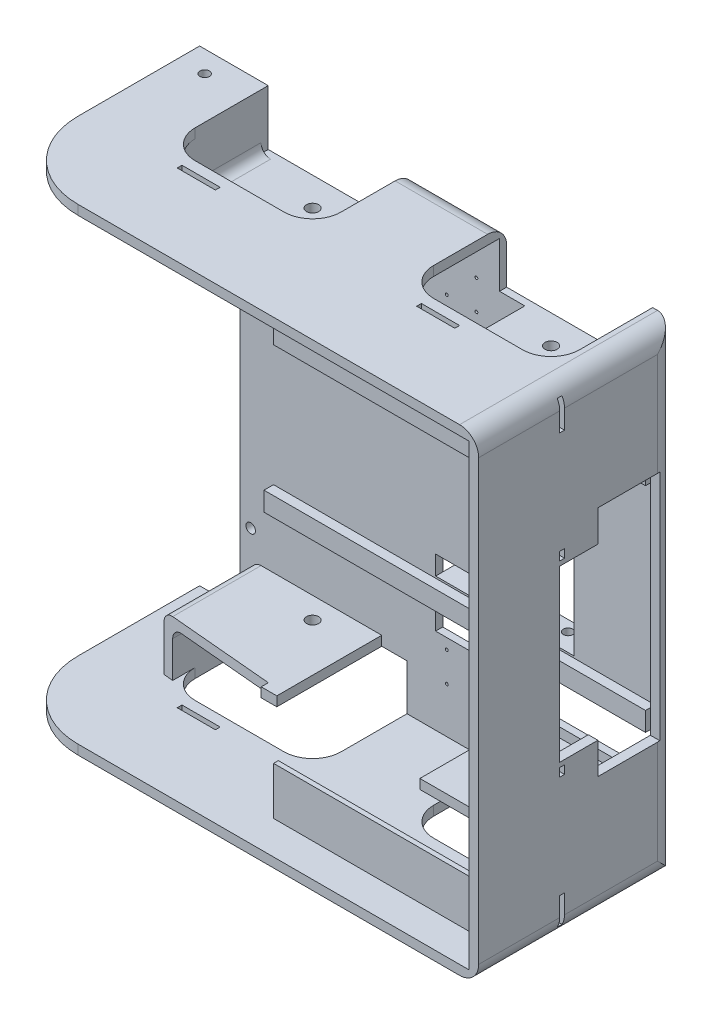
from build123d import *

# Parameters (mm, degrees)
SKETCH2_W           = 500
SKETCH2_H           = 500
BOSS_EXTRUDE1_DEPTH = 7.5
BOSS_EXTRUDE2_DEPTH = 200
SKETCH4_W           = 100
SKETCH4_H           = 10
BOSS_EXTRUDE3_DEPTH = 110
CUT_EXTRUDE3_REACH  = 598.285
CUT_EXTRUDE4_START  = -58
CUT_EXTRUDE4_DEPTH  = 58
SKETCH7_R           = 6.35
CUT_EXTRUDE5_DEPTH  = 500
SKETCH8_W           = 150
SKETCH8_H           = 50
CUT_EXTRUDE6_DEPTH  = 10
CUT_EXTRUDE9_DEPTH  = 10
SKETCH12_W          = 50
SKETCH12_H          = 20
BOSS_EXTRUDE4_DEPTH = 30
SKETCH13_R          = 5
CUT_EXTRUDE10_DEPTH = 500
SKETCH14_W          = 50
SKETCH14_H          = 20
CUT_EXTRUDE11_DEPTH = 1000
SKETCH15_W          = 399.926527146
SKETCH15_H          = 20
BOSS_EXTRUDE5_DEPTH = 10
CUT_EXTRUDE12_DEPTH = 500
SKETCH17_W          = 50
SKETCH17_H          = 480
CUT_EXTRUDE13_DEPTH = 500
FILLET2_R           = 20
CUT_EXTRUDE14_DEPTH = 38
SKETCH19_R          = 5
CUT_EXTRUDE15_DEPTH = 10
BOSS_EXTRUDE6_REACH = 408.202
SKETCH21_R          = 5
CUT_EXTRUDE16_DEPTH = 500
SKETCH22_W          = 40
SKETCH22_H          = 5
CUT_EXTRUDE17_DEPTH = 1000
SKETCH23_W          = 5
SKETCH23_H          = 30
SKETCH23_H_2        = 8.75
CUT_EXTRUDE18_DEPTH = 20
SKETCH25_R          = 1.5
CUT_EXTRUDE19_DEPTH = 50
SKETCH26_W          = 50
SKETCH26_H          = 20
BOSS_EXTRUDE7_DEPTH = 22.5
SKETCH28_R          = 5
CUT_EXTRUDE20_DEPTH = 250
SKETCH29_W          = 240
SKETCH29_H          = 5
BOSS_EXTRUDE8_DEPTH = 50


with BuildPart() as part:
    # Sketch2 → Boss-Extrude1 (new body)
    with BuildSketch(Plane.XY):
        Rectangle(SKETCH2_W, SKETCH2_H)
    extrude(amount=BOSS_EXTRUDE1_DEPTH)

    # Sketch3 → Boss-Extrude2 (add)
    with BuildSketch(Plane.XY.offset(7.5)):
        Polygon((-250, 250), (-250, 240), (-240, 240), (240, 240), (240, -240), (-240, -240), (-250, -240), (-250, -250), (250, -250), (250, 250), align=None)
    extrude(amount=BOSS_EXTRUDE2_DEPTH)

    # Sketch4 → Boss-Extrude3 (add)
    with BuildSketch(Plane.XY.offset(7.5)):
        with Locations((148.4, 187)):
            Rectangle(SKETCH4_W, SKETCH4_H)
        with Locations((148.4, -187)):
            Rectangle(SKETCH4_W, SKETCH4_H)
        with Locations((-101.6, 187)):
            Rectangle(SKETCH4_W, SKETCH4_H)
        with Locations((-101.6, -187)):
            Rectangle(SKETCH4_W, SKETCH4_H)
    extrude(amount=BOSS_EXTRUDE3_DEPTH)

    # Cut-Extrude3: up to this face of the body (flat: up to its plane)
    cut_extrude3_end = Plane(part.part.faces().sort_by_distance((148.4, 192, 62.5))[0])
    # Sketch5 → Cut-Extrude3 (cut, up to the picked face)
    with BuildSketch(Plane(origin=(0, 250, 0), x_dir=(1, 0, 0), z_dir=(0, 1, 0)), mode=Mode.PRIVATE) as cut_extrude3_sk1:
        with BuildLine():
            Line((71.9, 46.5), (224.9, 46.5))
            Line((224.9, 46.5), (224.9, -76.5))
            ThreePointArc((224.9, -76.5), (216.113203436, -97.713203436), (194.9, -106.5))
            Line((194.9, -106.5), (101.9, -106.5))
            ThreePointArc((101.9, -106.5), (80.686796564, -97.713203436), (71.9, -76.5))
            Line((71.9, -76.5), (71.9, 46.5))
        make_face()
    cut_extrude3_tool1 = split(extrude(cut_extrude3_sk1.sketch, amount=-CUT_EXTRUDE3_REACH, mode=Mode.PRIVATE), bisect_by=cut_extrude3_end, keep=Keep.BOTH, mode=Mode.PRIVATE)
    # Sketch5 → Cut-Extrude3 (cut, up to the picked face)
    with BuildSketch(Plane(origin=(0, 250, 0), x_dir=(1, 0, 0), z_dir=(0, 1, 0)), mode=Mode.PRIVATE) as cut_extrude3_sk2:
        with BuildLine():
            Line((-178.1, 46.5), (-178.1, -76.5))
            ThreePointArc((-178.1, -76.5), (-169.313203436, -97.713203436), (-148.1, -106.5))
            Line((-148.1, -106.5), (-55.1, -106.5))
            ThreePointArc((-55.1, -106.5), (-33.886796564, -97.713203436), (-25.1, -76.5))
            Line((-25.1, -76.5), (-25.1, 46.5))
            Line((-25.1, 46.5), (-178.1, 46.5))
        make_face()
    cut_extrude3_tool2 = split(extrude(cut_extrude3_sk2.sketch, amount=-CUT_EXTRUDE3_REACH, mode=Mode.PRIVATE), bisect_by=cut_extrude3_end, keep=Keep.BOTH, mode=Mode.PRIVATE)
    add(cut_extrude3_tool1.solids().sort_by(Axis((148.4, 250, 28.828888), (0, -1, 0)))[0], mode=Mode.SUBTRACT)
    add(cut_extrude3_tool2.solids().sort_by(Axis((-101.6, 250, 28.828888), (0, -1, 0)))[0], mode=Mode.SUBTRACT)

    # Sketch6 → Cut-Extrude4 (cut)
    with BuildSketch(Plane.XZ.offset(250).offset(CUT_EXTRUDE4_START)):
        with BuildLine():
            Line((224.9, 0), (71.9, 0))
            Line((71.9, 0), (71.9, 76.5))
            ThreePointArc((71.9, 76.5), (80.686796564, 97.713203436), (101.9, 106.5))
            Line((101.9, 106.5), (194.9, 106.5))
            ThreePointArc((194.9, 106.5), (216.113203436, 97.713203436), (224.9, 76.5))
            Line((224.9, 76.5), (224.9, 0))
        make_face()
        with BuildLine():
            Line((-25.1, 0), (-178.1, 0))
            Line((-178.1, 0), (-178.1, 76.5))
            ThreePointArc((-178.1, 76.5), (-169.313203436, 97.713203436), (-148.1, 106.5))
            Line((-148.1, 106.5), (-55.1, 106.5))
            ThreePointArc((-55.1, 106.5), (-33.886796564, 97.713203436), (-25.1, 76.5))
            Line((-25.1, 76.5), (-25.1, 0))
        make_face()
    extrude(amount=CUT_EXTRUDE4_DEPTH, mode=Mode.SUBTRACT)

    # Sketch7 → Cut-Extrude5 (cut, symmetric)
    with BuildSketch(Plane(origin=(0, -182, 0), x_dir=(1, 0, 0), z_dir=(0, 1, 0))):
        with Locations(Location((148.4, -30, 0), (0, 0, 270))):
            Circle(SKETCH7_R)
        with Locations(Location((-101.6, -30, 0), (0, 0, 270))):
            Circle(SKETCH7_R)
    extrude(amount=CUT_EXTRUDE5_DEPTH, both=True, mode=Mode.SUBTRACT)

    # Sketch8 → Cut-Extrude6 (cut)
    with BuildSketch(Plane.XY.offset(7.5)):
        with Locations((159.9, 147)):
            Rectangle(SKETCH8_W, SKETCH8_H)
        with Locations((159.9, -147)):
            Rectangle(SKETCH8_W, SKETCH8_H)
    extrude(amount=-CUT_EXTRUDE6_DEPTH, mode=Mode.SUBTRACT)

    # Sketch11 → Cut-Extrude9 (cut)
    with BuildSketch(Plane(origin=(0, -182, 0), x_dir=(1, 0, 0), z_dir=(0, 1, 0))):
        Polygon((-151.6, -117.5), (-91.6, -117.5), (-67.982681626, -117.5), (-67.982681626, -110), (-151.6, -102.5), align=None)
    cut_extrude9 = extrude(amount=-CUT_EXTRUDE9_DEPTH, mode=Mode.SUBTRACT)

    # Mirror1: Cut-Extrude9 across plane
    add(cut_extrude9.mirror(Plane.ZX), mode=Mode.SUBTRACT)

    # Sketch12 → Boss-Extrude4 (add)
    with BuildSketch(Plane.XY.offset(7.5)):
        with Locations((125, -110)):
            Rectangle(SKETCH12_W, SKETCH12_H)
        with Locations((125, 110)):
            Rectangle(SKETCH12_W, SKETCH12_H)
    extrude(amount=-BOSS_EXTRUDE4_DEPTH)

    # Sketch13 → Cut-Extrude10 (cut, symmetric)
    with BuildSketch(Plane.XZ.offset(-100)):
        with Locations(Location((125, -11.25, 0), (0, 0, 270))):
            Circle(SKETCH13_R)
    extrude(amount=CUT_EXTRUDE10_DEPTH, both=True, mode=Mode.SUBTRACT)

    # Sketch14 → Cut-Extrude11 (cut)
    with BuildSketch(Plane(origin=(0, 0, 0), x_dir=(-1, 0, 0), z_dir=(0, 0, -1))):
        Polygon((-150, -100), (-100, -100), (-90.165859907, -100), (-90.165859907, 100), (-100, 100), (-150, 100), align=None)
        with Locations((-29.9, -140)):
            Rectangle(SKETCH14_W, SKETCH14_H)
        with Locations((-29.9, -90)):
            Rectangle(SKETCH14_W, SKETCH14_H)
        with Locations((-29.9, 90)):
            Rectangle(SKETCH14_W, SKETCH14_H)
        with Locations((-29.9, 140)):
            Rectangle(SKETCH14_W, SKETCH14_H)
    extrude(amount=-CUT_EXTRUDE11_DEPTH, mode=Mode.SUBTRACT)

    # Sketch15 → Boss-Extrude5 (add)
    with BuildSketch(Plane.XY.offset(7.5)):
        with Locations((34.936736427, 112)):
            Rectangle(SKETCH15_W, SKETCH15_H)
        with Locations((34.936736427, -112)):
            Rectangle(SKETCH15_W, SKETCH15_H)
    extrude(amount=BOSS_EXTRUDE5_DEPTH)

    # Sketch16 → Cut-Extrude12 (cut)
    with BuildSketch(Plane(origin=(0, 250, 0), x_dir=(1, 0, 0), z_dir=(0, 1, 0))):
        with BuildLine():
            Line((-250, -127.5), (-250, 0))
            Line((-250, 0), (-350.342339136, 0))
            Line((-350.342339136, 0), (-350.342339136, -261.626610271))
            Line((-350.342339136, -261.626610271), (250, -261.626610271))
            Line((250, -261.626610271), (250, -207.5))
            Line((250, -207.5), (-170, -207.5))
            ThreePointArc((-170, -207.5), (-226.568542495, -184.068542495), (-250, -127.5))
        make_face()
    extrude(amount=-CUT_EXTRUDE12_DEPTH, mode=Mode.SUBTRACT)

    # Sketch17 → Cut-Extrude13 (cut)
    with BuildSketch(Plane.XY.offset(7.5)):
        with Locations((-225, 0)):
            Rectangle(SKETCH17_W, SKETCH17_H)
    extrude(amount=-CUT_EXTRUDE13_DEPTH, mode=Mode.SUBTRACT)

    # Fillet2
    # the kernel refuses this fillet: 20 mm, written as the material it takes off along each edge
    with BuildSketch(Plane(origin=(-75.1, -250, 0), x_dir=(0, 0, 1), z_dir=(1, 0, 0)), Plane(origin=(121.9, 250, 0), x_dir=(0, 0, 1), z_dir=(-1, 0, 0))) as fillet2_piece_1:
        with BuildLine():
            CenterArc((FILLET2_R, -FILLET2_R), FILLET2_R, 90, 90)
            Line((0, -FILLET2_R), (0, 0))
            Line((0, 0), (FILLET2_R, 0))
        make_face()
    extrude(amount=197, mode=Mode.SUBTRACT)
    with BuildSketch(Plane(origin=(250, -300, 0), x_dir=(0, 0, 1), z_dir=(0, 1, 0))) as fillet2_piece_2:
        with BuildLine():
            CenterArc((FILLET2_R, -FILLET2_R), FILLET2_R, 90, 90)
            Line((0, -FILLET2_R), (0, 0))
            Line((0, 0), (FILLET2_R, 0))
        make_face()
    extrude(amount=600, mode=Mode.SUBTRACT)
    with BuildSketch(Plane(origin=(250, -250, -50), x_dir=(-1, 0, 0), z_dir=(0, 0, 1))) as fillet2_piece_3:
        with BuildLine():
            CenterArc((FILLET2_R, -FILLET2_R), FILLET2_R, 90, 90)
            Line((0, -FILLET2_R), (0, 0))
            Line((0, 0), (FILLET2_R, 0))
        make_face()
    extrude(amount=307.5, mode=Mode.SUBTRACT)
    with BuildSketch(Plane(origin=(250, 250, -50), x_dir=(-1, 0, 0), z_dir=(0, 0, 1))) as fillet2_piece_4:
        with BuildLine():
            CenterArc((FILLET2_R, FILLET2_R), FILLET2_R, 180, 90)
            Line((0, FILLET2_R), (0, 0))
            Line((0, 0), (FILLET2_R, 0))
        make_face()
    extrude(amount=307.5, mode=Mode.SUBTRACT)

    # Sketch18 → Cut-Extrude14 (cut)
    with BuildSketch(Plane.ZY.offset(-240)):
        Polygon((17.5, 122), (82.5, 122), (82.5, 89), (122.5, 89), (122.5, -89), (82.5, -89), (82.5, -122), (17.5, -122), align=None)
    extrude(amount=-CUT_EXTRUDE14_DEPTH, mode=Mode.SUBTRACT)

    # Sketch19 → Cut-Extrude15 (cut)
    with BuildSketch(Plane.XY.offset(7.5)):
        with Locations((-189, 153.5)):
            Circle(SKETCH19_R)
        with Locations(Location((-189, -153.5, 0), (0, 0, 180))):
            Circle(SKETCH19_R)
    extrude(amount=-CUT_EXTRUDE15_DEPTH, mode=Mode.SUBTRACT)

    # Boss-Extrude6: up to this plane
    boss_extrude6_end = Plane(origin=(-67.982681626, 192, 110), z_dir=(-0.08933570149231775, 0, 0.9960015725082343))
    # Sketch20 → Boss-Extrude6 (add, up to the surface)
    with BuildSketch(Plane.XY.offset(7.5), mode=Mode.PRIVATE) as boss_extrude6_sk1:
        with BuildLine():
            Line((-178.1, 240), (-178.1, 202))
            ThreePointArc((-178.1, 202), (-175.171067812, 194.928932188), (-168.1, 192))
            Line((-168.1, 192), (-151.6, 192))
            Line((-151.6, 192), (-151.6, 182))
            Line((-151.6, 182), (-178.1, 182))
            ThreePointArc((-178.1, 182), (-185.171067812, 184.928932188), (-188.1, 192))
            Line((-188.1, 192), (-188.1, 240))
            Line((-188.1, 240), (-178.1, 240))
        make_face()
    boss_extrude6_tool1 = split(extrude(boss_extrude6_sk1.sketch, amount=BOSS_EXTRUDE6_REACH, mode=Mode.PRIVATE), bisect_by=boss_extrude6_end, keep=Keep.BOTH, mode=Mode.PRIVATE)
    boss_extrude6 = boss_extrude6_tool1.solids().sort_by_distance((-178.785292, 221, 7.5))[0]
    add(boss_extrude6)

    # Mirror2: Boss-Extrude6 across plane
    add(boss_extrude6.mirror(Plane.ZX))

    # Sketch21 → Cut-Extrude16 (cut, symmetric)
    with BuildSketch(Plane(origin=(0, -240, 0), x_dir=(1, 0, 0), z_dir=(0, 1, 0))):
        with Locations(Location((-222.174829667, -22.5, 0), (0, 0, 270))):
            Circle(SKETCH21_R)
    extrude(amount=CUT_EXTRUDE16_DEPTH, both=True, mode=Mode.SUBTRACT)

    # Sketch22 → Cut-Extrude17 (cut)
    with BuildSketch(Plane.XZ.offset(250)):
        with Locations((-131, 120)):
            Rectangle(SKETCH22_W, SKETCH22_H)
        with Locations((120, 120)):
            Rectangle(SKETCH22_W, SKETCH22_H)
    extrude(amount=-CUT_EXTRUDE17_DEPTH, mode=Mode.SUBTRACT)

    # Sketch23 → Cut-Extrude18 (cut)
    with BuildSketch(Plane(origin=(250, 0, 0), x_dir=(0, 0, -1), z_dir=(1, 0, 0))):
        with Locations((-120, -225)):
            Rectangle(SKETCH23_W, SKETCH23_H)
        with Locations((-120, -98.125)):
            Rectangle(SKETCH23_W, SKETCH23_H_2)
        with Locations((-120, 98.125)):
            Rectangle(SKETCH23_W, SKETCH23_H_2)
        with Locations((-120, 225)):
            Rectangle(SKETCH23_W, SKETCH23_H)
    extrude(amount=-CUT_EXTRUDE18_DEPTH, mode=Mode.SUBTRACT)

    # Sketch25 → Cut-Extrude19 (cut)
    with BuildSketch(Plane.XY.offset(7.5)):
        with Locations((16.625, -161.130490871)):
            Circle(SKETCH25_R)
        with Locations((47.625, -161.130490871)):
            Circle(SKETCH25_R)
        with Locations((47.625, -192.130490871)):
            Circle(SKETCH25_R)
        with Locations((16.625, -192.130490871)):
            Circle(SKETCH25_R)
        with Locations(Location((16.625, 192.130490871, 0), (0, 0, 180))):
            Circle(SKETCH25_R)
        with Locations(Location((47.625, 192.130490871, 0), (0, 0, 180))):
            Circle(SKETCH25_R)
        with Locations(Location((47.625, 161.130490871, 0), (0, 0, 180))):
            Circle(SKETCH25_R)
        with Locations(Location((16.625, 161.130490871, 0), (0, 0, 180))):
            Circle(SKETCH25_R)
    extrude(amount=-CUT_EXTRUDE19_DEPTH, mode=Mode.SUBTRACT)

    # Sketch26 → Boss-Extrude7 (add)
    with BuildSketch(Plane(origin=(0, 0, 0), x_dir=(-1, 0, 0), z_dir=(0, 0, -1))):
        with Locations((-29.9, 110)):
            Rectangle(SKETCH26_W, SKETCH26_H)
        with Locations((-29.9, -110)):
            Rectangle(SKETCH26_W, SKETCH26_H)
    extrude(amount=BOSS_EXTRUDE7_DEPTH)

    # Sketch28 → Cut-Extrude20 (cut)
    with BuildSketch(Plane(origin=(0, 120, 0), x_dir=(1, 0, 0), z_dir=(0, 1, 0))):
        with Locations(Location((29.9, 11.25, 0), (0, 0, 270))):
            Circle(SKETCH28_R)
    extrude(amount=-CUT_EXTRUDE20_DEPTH, mode=Mode.SUBTRACT)

    # Sketch29 → Boss-Extrude8 (add)
    with BuildSketch(Plane(origin=(0, -240, 0), x_dir=(1, 0, 0), z_dir=(0, 1, 0))):
        with Locations((120, -170)):
            Rectangle(SKETCH29_W, SKETCH29_H)
    boss_extrude8 = extrude(amount=BOSS_EXTRUDE8_DEPTH)

    # Mirror3: Boss-Extrude8 across plane
    add(boss_extrude8.mirror(Plane.ZX))


solid = part.part
